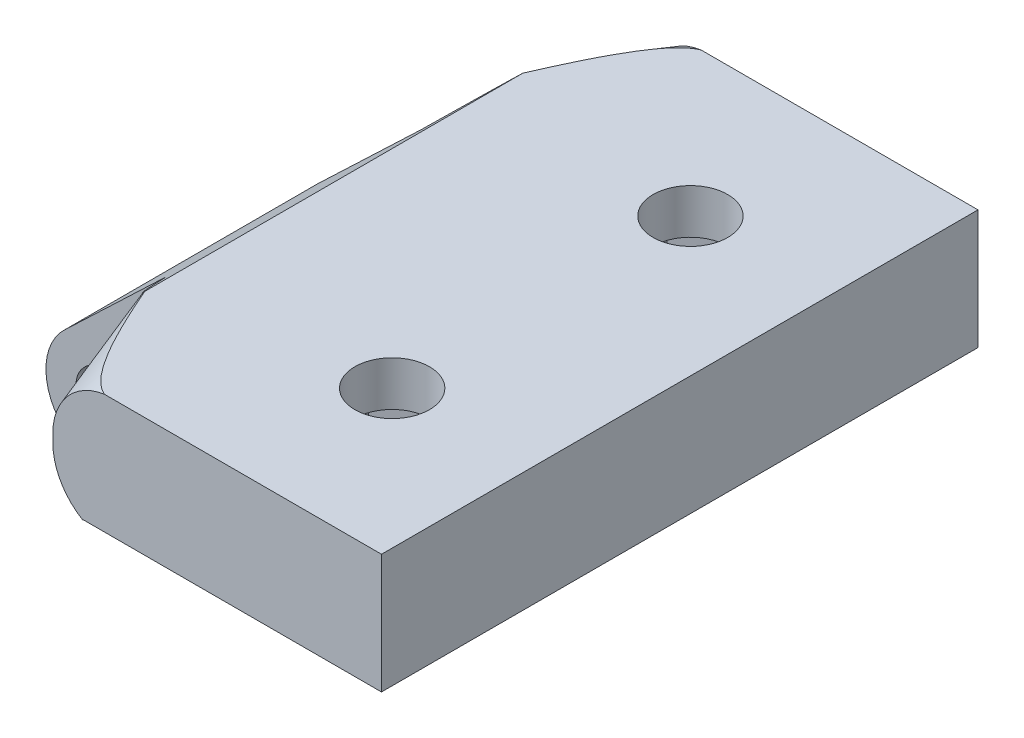
from build123d import *

# Parameters (mm, degrees)
SKETCH1_R               = 2
BOSS_EXTRUDE1_DEPTH     = 20
CUT_EXTRUDE1_DEPTH      = 37.932370625
CUT_EXTRUDE1_DEPTH_BACK = 37.932370625
SKETCH2_W               = 20
SKETCH2_H               = 16.5
FILLET1_R               = 4
CHAMFER1_SIZE           = 4
CHAMFER1_SIZE_2         = 11.616843511
SKETCH4_R               = 2.5
CUT_EXTRUDE2_DEPTH      = 40.446165847
CUT_EXTRUDE3_START      = -3
CUT_EXTRUDE3_DEPTH      = 37.446165847


with BuildPart() as part:
    # Sketch1 → Boss-Extrude1 (new, symmetric)
    with BuildSketch(Plane.XY):
        with BuildLine():
            Line((-2.75862069, 2.896551724), (6.8, 12))
            Line((6.8, 12), (30, 12))
            Line((30, 12), (30, 4))
            Line((30, 4), (10, 4))
            Line((10, 4), (2.75862069, -2.896551724))
            ThreePointArc((2.75862069, -2.896551724), (-2.896551724, -2.75862069), (-2.75862069, 2.896551724))
        make_face()
        Circle(SKETCH1_R, mode=Mode.SUBTRACT)
    extrude(amount=BOSS_EXTRUDE1_DEPTH, both=True)

    # Sketch2 → Cut-Extrude1 (cut, two sides: drawn at the far end of the back side and taken through both)
    with BuildSketch(Plane.XZ.offset(-4).offset(-CUT_EXTRUDE1_DEPTH_BACK)):
        with Locations((-2, 16.75)):
            Rectangle(SKETCH2_W, SKETCH2_H)
        with Locations((-2, -16.75)):
            Rectangle(SKETCH2_W, SKETCH2_H)
    extrude(amount=CUT_EXTRUDE1_DEPTH + CUT_EXTRUDE1_DEPTH_BACK, mode=Mode.SUBTRACT)

    # Fillet1
    # the kernel refuses this fillet: 4 mm, written as the material it takes off along each edge
    with BuildSketch(Plane(origin=(8, 2.095238095, -33.4221588), x_dir=(0.7241379310344825, 0.6896551724137934, 0), z_dir=(0, 0, 1))) as fillet1_piece_1:
        with BuildLine():
            CenterArc((6.599216221, 1.129177032), FILLET1_R, 136.397181027, 60)
            Line((3.702664496, 3.887797721), (3.644733462, 3.942970135))
            Line((3.644733462, 3.942970135), (-0.057931034, 0.055172414))
            Line((-0.057931034, 0.055172414), (0, -0.08))
            ThreePointArc((0, -0.08), (1.380952381, -0.08), (2.685158533, -0.022583541))
            Line((2.685158533, -0.022583541), (2.761904762, 0))
        make_face()
    extrude(amount=24.9221588, mode=Mode.SUBTRACT)
    with BuildSketch(Plane(origin=(8, 12, -8.5), x_dir=(0, -1, 0), z_dir=(0, 0, -1))) as fillet1_piece_2:
        with BuildLine():
            CenterArc((FILLET1_R, -FILLET1_R), FILLET1_R, 90, 90)
            Line((0, -FILLET1_R), (-FILLET1_R * 0.02, -FILLET1_R))
            Line((-FILLET1_R * 0.02, -FILLET1_R), (-FILLET1_R * 0.02, FILLET1_R * 0.02))
            Line((-FILLET1_R * 0.02, FILLET1_R * 0.02), (FILLET1_R, FILLET1_R * 0.02))
            Line((FILLET1_R, FILLET1_R * 0.02), (FILLET1_R, 0))
        make_face()
    extrude(amount=21.5, mode=Mode.SUBTRACT)
    with BuildSketch(Plane(origin=(8, 12, 8.5), x_dir=(0, -1, 0), z_dir=(0, 0, 1))) as fillet1_piece_3:
        with BuildLine():
            CenterArc((FILLET1_R, FILLET1_R), FILLET1_R, 180, 90)
            Line((0, FILLET1_R), (-FILLET1_R * 0.02, FILLET1_R))
            Line((-FILLET1_R * 0.02, FILLET1_R), (-FILLET1_R * 0.02, -FILLET1_R * 0.02))
            Line((-FILLET1_R * 0.02, -FILLET1_R * 0.02), (FILLET1_R, -FILLET1_R * 0.02))
            Line((FILLET1_R, -FILLET1_R * 0.02), (FILLET1_R, 0))
        make_face()
    extrude(amount=21.5, mode=Mode.SUBTRACT)
    with BuildSketch(Plane(origin=(8, 2.095238095, 33.4221588), x_dir=(0.7241379310344824, 0.6896551724137936, 0), z_dir=(0, 0, -1))) as fillet1_piece_4:
        with BuildLine():
            CenterArc((6.599216221, -1.129177032), FILLET1_R, 163.602818973, 60)
            Line((3.702664496, -3.887797721), (3.644733462, -3.942970135))
            Line((3.644733462, -3.942970135), (-0.057931034, -0.055172414))
            Line((-0.057931034, -0.055172414), (0, 0.08))
            ThreePointArc((0, 0.08), (1.380952381, 0.08), (2.685158533, 0.022583541))
            Line((2.685158533, 0.022583541), (2.761904762, 0))
        make_face()
    extrude(amount=24.9221588, mode=Mode.SUBTRACT)

    # Chamfer1
    # the kernel refuses this chamfer: 11.616843511, 4 mm, written as the material it adds along each edge
    with BuildSketch(Plane(origin=(12, 8, -8.5), x_dir=(-1, 0, 0), z_dir=(0, -1, 0))) as chamfer1_piece_1_section:
        Polygon((4 + CHAMFER1_SIZE, 0), (4, CHAMFER1_SIZE_2), (4, 0), align=None)
    chamfer1_piece_1 = revolve(axis=Axis((12, 8, -8.5), (0, 0, -1)), revolution_arc=359.64, mode=Mode.PRIVATE)
    chamfer1_piece_1 = split(chamfer1_piece_1, bisect_by=Plane(origin=(6.815559228, 9.673675178, -20), z_dir=(0, 0, 1)), keep=Keep.TOP, mode=Mode.PRIVATE)
    chamfer1_piece_1 = split(chamfer1_piece_1, bisect_by=Plane(origin=(6.815559228, 12, -12.048091189), z_dir=(0, -1, 0)), keep=Keep.TOP, mode=Mode.PRIVATE)
    chamfer1_piece_1 = split(chamfer1_piece_1, bisect_by=Plane(origin=(5.646379541, 10.901313849, -12.048091189), z_dir=(0.6896551724137935, -0.7241379310344824, 0)), keep=Keep.TOP, mode=Mode.PRIVATE)
    chamfer1_piece_1 = split(chamfer1_piece_1, bisect_by=Plane(origin=(11.163620921, 5.1082104, -12.048091189), z_dir=(-0.6896551724137935, 0.7241379310344825, 0)), keep=Keep.TOP, mode=Mode.PRIVATE)
    add(chamfer1_piece_1)
    with BuildSketch(Plane(origin=(8, 7.464101615, -8.5), x_dir=(-0.9944459243087849, 0, 0.10524877018591122), z_dir=(0, 1, 0))) as chamfer1_piece_2_section:
        Polygon((CHAMFER1_SIZE * 0.994445924309, -CHAMFER1_SIZE * 0.105248770186), (-CHAMFER1_SIZE_2 * 0.105248770183, -CHAMFER1_SIZE_2 * 0.994445924283), (0, 0), align=None)
    chamfer1_piece_2 = extrude(amount=0.535898385, mode=Mode.PRIVATE)
    chamfer1_piece_2 = split(chamfer1_piece_2, bisect_by=Plane(origin=(6.666533122, 7.732050808, -20), z_dir=(0, 0, 1)), keep=Keep.TOP, mode=Mode.PRIVATE)
    add(chamfer1_piece_2)
    with BuildSketch(Plane(origin=(12, 7.464101615, -8.5), x_dir=(-1, 0, 0), z_dir=(0, 1, 0))) as chamfer1_piece_3_section:
        Polygon((4 + CHAMFER1_SIZE, 0), (4, -CHAMFER1_SIZE_2), (4, 0), align=None)
    chamfer1_piece_3 = revolve(axis=Axis((12, 7.464101615, -8.5), (0, 0, 1)), revolution_arc=359.64, mode=Mode.PRIVATE)
    chamfer1_piece_3 = split(chamfer1_piece_3, bisect_by=Plane(origin=(6.73533338, 5.888138527, -20), z_dir=(0, 0, 1)), keep=Keep.TOP, mode=Mode.PRIVATE)
    chamfer1_piece_3 = split(chamfer1_piece_3, bisect_by=Plane(origin=(6.73533338, 12, -12.010330429), z_dir=(0, -1, 0)), keep=Keep.TOP, mode=Mode.PRIVATE)
    chamfer1_piece_3 = split(chamfer1_piece_3, bisect_by=Plane(origin=(3.713793343, 9.060755565, -12.010330429), z_dir=(0.6896551724137935, -0.7241379310344824, 0)), keep=Keep.TOP, mode=Mode.PRIVATE)
    chamfer1_piece_3 = split(chamfer1_piece_3, bisect_by=Plane(origin=(9.231034723, 3.267652117, -12.010330429), z_dir=(-0.6896551724137935, 0.7241379310344825, 0)), keep=Keep.TOP, mode=Mode.PRIVATE)
    add(chamfer1_piece_3)
    with BuildSketch(Plane(origin=(12, 8, 8.5), x_dir=(-0.9999802608561372, -0.006283143965558626, 0), z_dir=(-0.006283143965558626, 0.9999802608561372, 0))) as chamfer1_piece_4_section:
        Polygon((-4, CHAMFER1_SIZE_2), (-4 - CHAMFER1_SIZE, 0), (-4, 0), align=None)
    chamfer1_piece_4 = revolve(axis=Axis((12, 8, 8.5), (0, 0, 1)), revolution_arc=359.64, mode=Mode.PRIVATE)
    chamfer1_piece_4 = split(chamfer1_piece_4, bisect_by=Plane(origin=(8.929227056, 11.070772944, 20), z_dir=(0, 0, -1)), keep=Keep.TOP, mode=Mode.PRIVATE)
    chamfer1_piece_4 = split(chamfer1_piece_4, bisect_by=Plane(origin=(8.929227056, 12, 13.636607489), z_dir=(0, -1, 0)), keep=Keep.TOP, mode=Mode.PRIVATE)
    chamfer1_piece_4 = split(chamfer1_piece_4, bisect_by=Plane(origin=(7.452453946, 12.62138471, 13.636607489), z_dir=(0.6896551724137935, -0.7241379310344824, 0)), keep=Keep.TOP, mode=Mode.PRIVATE)
    chamfer1_piece_4 = split(chamfer1_piece_4, bisect_by=Plane(origin=(12.969695325, 6.828281262, 13.636607489), z_dir=(-0.6896551724137935, 0.7241379310344825, 0)), keep=Keep.TOP, mode=Mode.PRIVATE)
    add(chamfer1_piece_4)
    with BuildSketch(Plane(origin=(8, 8, 8.5), x_dir=(0.012547158200392034, 0, 0.9999212813122313), z_dir=(0, -1, 0))) as chamfer1_piece_5_section:
        Polygon((CHAMFER1_SIZE_2 * 0.999921281287, CHAMFER1_SIZE_2 * 0.0125471582001), (-CHAMFER1_SIZE * 0.0125471582004, CHAMFER1_SIZE * 0.999921281312), (0, 0), align=None)
    chamfer1_piece_5 = extrude(amount=0.535898385, mode=Mode.PRIVATE)
    chamfer1_piece_5 = split(chamfer1_piece_5, bisect_by=Plane(origin=(6.666533122, 7.732050808, 20), z_dir=(0, 0, -1)), keep=Keep.TOP, mode=Mode.PRIVATE)
    add(chamfer1_piece_5)
    with BuildSketch(Plane(origin=(12, 7.464101615, 8.5), x_dir=(-0.9999802608561402, 0.006283143965082117, 0), z_dir=(-0.006283143965082117, -0.9999802608561402, 0))) as chamfer1_piece_6_section:
        Polygon((-4, -CHAMFER1_SIZE_2), (-4 - CHAMFER1_SIZE, 0), (-4, 0), align=None)
    chamfer1_piece_6 = revolve(axis=Axis((12, 7.464101615, 8.5), (0, 0, -1)), revolution_arc=359.64, mode=Mode.PRIVATE)
    chamfer1_piece_6 = split(chamfer1_piece_6, bisect_by=Plane(origin=(8.748719475, 3.446621368, 20), z_dir=(0, 0, -1)), keep=Keep.TOP, mode=Mode.PRIVATE)
    chamfer1_piece_6 = split(chamfer1_piece_6, bisect_by=Plane(origin=(8.748719475, 12, 12.595227268), z_dir=(0, -1, 0)), keep=Keep.TOP, mode=Mode.PRIVATE)
    chamfer1_piece_6 = split(chamfer1_piece_6, bisect_by=Plane(origin=(3.55025715, 8.905006809, 12.595227268), z_dir=(0.6896551724137935, -0.7241379310344824, 0)), keep=Keep.TOP, mode=Mode.PRIVATE)
    chamfer1_piece_6 = split(chamfer1_piece_6, bisect_by=Plane(origin=(9.067498529, 3.111903361, 12.595227268), z_dir=(-0.6896551724137935, 0.7241379310344825, 0)), keep=Keep.TOP, mode=Mode.PRIVATE)
    add(chamfer1_piece_6)

    # Sketch4 → Cut-Extrude2 (cut, through all)
    with BuildSketch(Plane(origin=(0, 12, 0), x_dir=(1, 0, 0), z_dir=(0, 1, 0))):
        with Locations(Location((20.715624268, -10, 0), (0, 0, 180))):
            Circle(SKETCH4_R)
    cut_extrude2 = extrude(amount=-CUT_EXTRUDE2_DEPTH, mode=Mode.SUBTRACT)

    # Sketch5 → Cut-Extrude3 (cut, through all)
    with BuildSketch(Plane(origin=(0, 12, 0), x_dir=(1, 0, 0), z_dir=(0, 1, 0)).offset(CUT_EXTRUDE3_START)):
        Polygon((20.715624268, -14.330127019), (24.465624268, -12.165063509), (24.465624268, -7.834936491), (20.715624268, -5.669872981), (16.965624268, -7.834936491), (16.965624268, -12.165063509), align=None)
    cut_extrude3 = extrude(amount=-CUT_EXTRUDE3_DEPTH, mode=Mode.SUBTRACT)

    # Mirror1: Cut-Extrude2, Cut-Extrude3 across plane
    add(cut_extrude2.mirror(Plane.XY), mode=Mode.SUBTRACT)
    add(cut_extrude3.mirror(Plane.XY), mode=Mode.SUBTRACT)


solid = part.part
